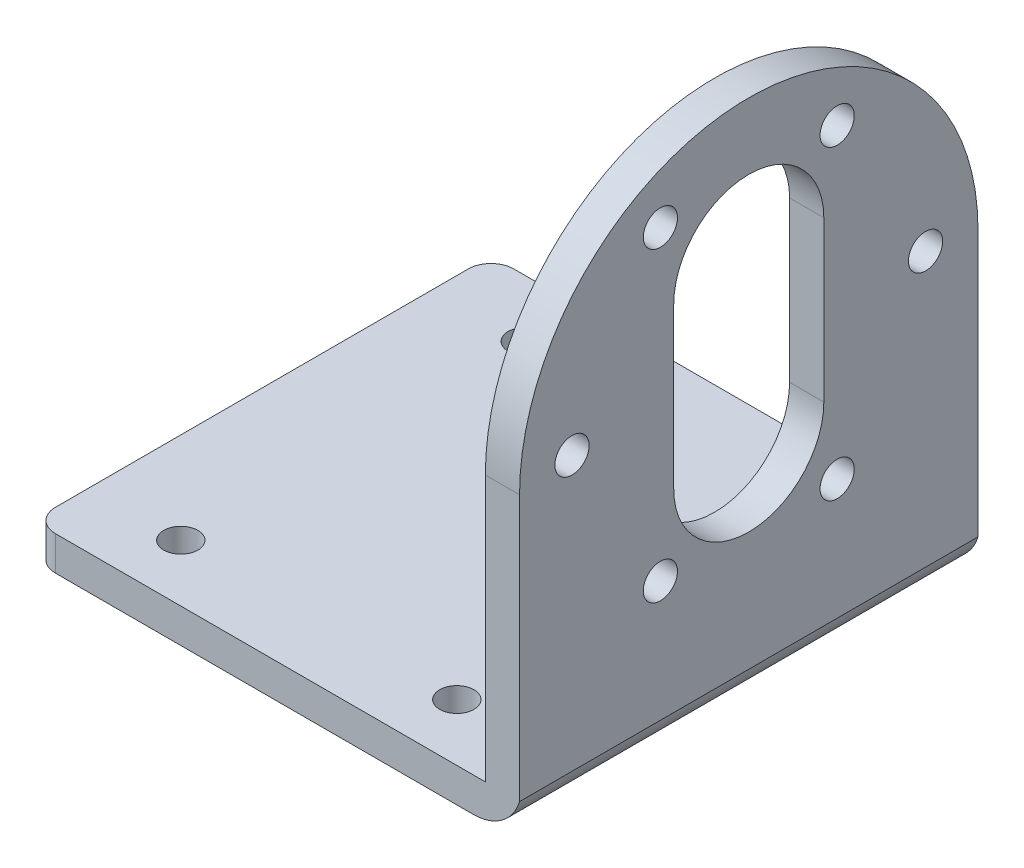
from build123d import *

# Parameters (mm, degrees)
BOSS_EXTRUDE1_DEPTH = 40.2
CUT_EXTRUDE1_START  = -3
CUT_EXTRUDE1_DEPTH  = 3
CUT_EXTRUDE4_DEPTH  = 40
SKETCH8_R           = 1.5
CUT_EXTRUDE5_DEPTH  = 40
FILLET2_R           = 2
SKETCH5_R           = 1.5
CUT_EXTRUDE6_DEPTH  = 73.958138682


# Read off the part's stored shape, not the designer's step: Cut-Extrude1
with BuildPart() as part:
    # Sketch1 → Boss-Extrude1 (new body)
    with BuildSketch(Plane.XY):
        with BuildLine():
            Line((-4.042288133, 0), (-42.7, 0))
            Line((-42.7, 0), (-42.7, 3))
            Line((-42.7, 3), (-3, 3))
            Line((-3, 3), (-3, 46.4))
            Line((-3, 46.4), (0, 46.4))
            Line((0, 46.4), (0, 3))
            ThreePointArc((0, 3), (-1.525340907, 0.831940258), (-4.042288133, 0))
        make_face()
    extrude(amount=BOSS_EXTRUDE1_DEPTH)

    # Cut-Extrude1 outline → Cut-Extrude1 (cut)
    with BuildSketch(Plane(origin=(0, 0, 0), x_dir=(0, 0, -1), z_dir=(1, 0, 0)).offset(CUT_EXTRUDE1_START)):
        with BuildLine():
            ThreePointArc((-40.2, 26.3), (-34.312846302, 40.512846302), (-20.1, 46.4))
            Line((-20.1, 46.4), (-40.2, 46.4))
            Line((-40.2, 46.4), (-40.2, 26.3))
        make_face()
        with BuildLine():
            ThreePointArc((-20.1, 46.4), (-5.887153698, 40.512846302), (0, 26.3))
            Line((0, 26.3), (0, 46.4))
            Line((0, 46.4), (-20.1, 46.4))
        make_face()
    extrude(amount=CUT_EXTRUDE1_DEPTH, mode=Mode.SUBTRACT)

    # Sketch7 → Cut-Extrude4 (cut)
    with BuildSketch(Plane(origin=(0, 0, 0), x_dir=(0, 0, -1), z_dir=(1, 0, 0))):
        with BuildLine():
            Line((-26.68, 34), (-26.68, 20))
            ThreePointArc((-26.68, 20), (-20.1, 13.42), (-13.52, 20))
            Line((-13.52, 20), (-13.52, 34))
            ThreePointArc((-13.52, 34), (-20.1, 40.58), (-26.68, 34))
        make_face()
    extrude(amount=-CUT_EXTRUDE4_DEPTH, mode=Mode.SUBTRACT)

    # Sketch8 → Cut-Extrude5 (cut)
    with BuildSketch(Plane(origin=(0, 0, 0), x_dir=(0, 0, -1), z_dir=(1, 0, 0))):
        with Locations(Location((-35.6, 27, 0), (0, 0, 90))):
            Circle(SKETCH8_R)
        with Locations(Location((-27.85, 40.423393759, 0), (0, 0, 90))):
            Circle(SKETCH8_R)
        with Locations(Location((-12.35, 40.423393759, 0), (0, 0, 90))):
            Circle(SKETCH8_R)
        with Locations(Location((-4.6, 27, 0), (0, 0, 90))):
            Circle(SKETCH8_R)
        with Locations(Location((-12.35, 13.576606241, 0), (0, 0, 90))):
            Circle(SKETCH8_R)
        with Locations(Location((-27.85, 13.576606241, 0), (0, 0, 90))):
            Circle(SKETCH8_R)
    extrude(amount=-CUT_EXTRUDE5_DEPTH, mode=Mode.SUBTRACT)

    # Fillet2
    fillet2_edges = [part.edges().sort_by_distance(p)[0] for p in [
        (-42.7, 1.5, 40.2),
        (-42.7, 1.5, 0),
    ]]
    fillet(fillet2_edges, radius=FILLET2_R)

    # Sketch5 → Cut-Extrude6 (cut, through all)
    with BuildSketch(Plane(origin=(0, 3, 0), x_dir=(1, 0, 0), z_dir=(0, 1, 0))):
        with Locations(Location((-10.5, -5, 0), (0, 0, 180))):
            Circle(SKETCH5_R)
        with Locations(Location((-10.5, -35.2, 0), (0, 0, 180))):
            Circle(SKETCH5_R)
        with Locations(Location((-34.7, -35.2, 0), (0, 0, 180))):
            Circle(SKETCH5_R)
        with Locations(Location((-34.7, -5, 0), (0, 0, 180))):
            Circle(SKETCH5_R)
    extrude(amount=-CUT_EXTRUDE6_DEPTH, mode=Mode.SUBTRACT)


solid = part.part
